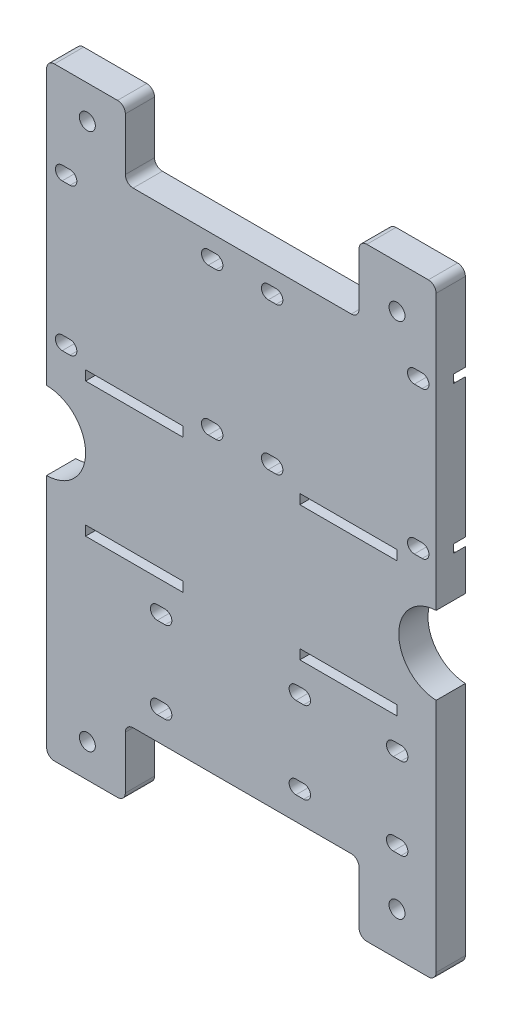
from build123d import *

# Parameters (mm, degrees)
SKETCH1_W                            = 100
SKETCH1_H                            = 155
BOSS_EXTRUDE1_DEPTH                  = 7.5
SKETCH2_R                            = 2.05
SKETCH2_W                            = 60
SKETCH2_H                            = 17.5
HOLE_CUTOUTS_DEPTH                   = 185.611077674
SKETCH3_W                            = 25
SKETCH3_H                            = 2.5
BATTERY_STRAP_HOLES_DEPTH            = 185.611077674
H_BRIDGE_HOLES_DEPTH                 = 7.5
BATTERY_PROTECTION_BOARD_HOLES_DEPTH = 185.611077674
VOLTAGE_STEP_DOWN_BOARD_DEPTH        = 185.611077674
FILLET1_R                            = 2
CAMERA_WIRE_HOLE_DEPTH               = 185.611077674
BORE_START                           = -3
BORE_HOLES_DEPTH                     = 3


with BuildPart() as part:
    # Sketch1 → Boss-Extrude1 (new body)
    with BuildSketch(Plane.XY):
        with Locations((50, 77.5)):
            Rectangle(SKETCH1_W, SKETCH1_H)
    extrude(amount=BOSS_EXTRUDE1_DEPTH)

    # Sketch2 → Hole cutouts (cut, through all)
    with BuildSketch(Plane.XY.offset(7.5)):
        with Locations((10.45, 146.45)):
            Circle(SKETCH2_R)
        with Locations((89.95, 143.95)):
            Circle(SKETCH2_R)
        with Locations((89.95, 11.05)):
            Circle(SKETCH2_R)
        with Locations((10.45, 8.55)):
            Circle(SKETCH2_R)
        with Locations((50.2, 146.25)):
            Rectangle(SKETCH2_W, SKETCH2_H)
        with Locations((50.2, 8.75)):
            Rectangle(SKETCH2_W, SKETCH2_H)
    extrude(amount=-HOLE_CUTOUTS_DEPTH, mode=Mode.SUBTRACT)

    # Sketch3 → Battery strap holes (cut, through all)
    with BuildSketch(Plane.XY.offset(7.5)):
        with Locations((77.5, 55.25)):
            Rectangle(SKETCH3_W, SKETCH3_H)
        with Locations((22.5, 55.25)):
            Rectangle(SKETCH3_W, SKETCH3_H)
        with Locations((77.5, 89.75)):
            Rectangle(SKETCH3_W, SKETCH3_H)
        with Locations((22.5, 89.75)):
            Rectangle(SKETCH3_W, SKETCH3_H)
    extrude(amount=-BATTERY_STRAP_HOLES_DEPTH, mode=Mode.SUBTRACT)

    # Sketch4 → H-Bridge Holes (cut)
    with BuildSketch(Plane.XY.offset(7.5)):
        with BuildLine():
            Line((6, 133.51), (4, 133.51))
            ThreePointArc((4, 133.51), (2.25, 131.76), (4, 130.01))
            Line((4, 130.01), (6, 130.01))
            ThreePointArc((6, 130.01), (7.75, 131.76), (6, 133.51))
        make_face()
        with BuildLine():
            ThreePointArc((41.5, 133.51), (39.75, 131.76), (41.5, 130.01))
            Line((41.5, 130.01), (43.5, 130.01))
            ThreePointArc((43.5, 130.01), (45.25, 131.76), (43.5, 133.51))
            Line((43.5, 133.51), (41.5, 133.51))
        make_face()
        with BuildLine():
            Line((6, 95.75), (4, 95.75))
            ThreePointArc((4, 95.75), (2.25, 94), (4, 92.25))
            Line((4, 92.25), (6, 92.25))
            ThreePointArc((6, 92.25), (7.75, 94), (6, 95.75))
        make_face()
        with BuildLine():
            Line((43.5, 95.75), (41.5, 95.75))
            ThreePointArc((41.5, 95.75), (39.75, 94), (41.5, 92.25))
            Line((41.5, 92.25), (43.5, 92.25))
            ThreePointArc((43.5, 92.25), (45.25, 94), (43.5, 95.75))
        make_face()
    h_bridge_holes = extrude(amount=-H_BRIDGE_HOLES_DEPTH, mode=Mode.SUBTRACT)

    # Sketch6 → Battery Protection Board Holes (cut, through all)
    with BuildSketch(Plane.XY.offset(7.5)):
        with BuildLine():
            Line((66, 27), (64, 27))
            ThreePointArc((64, 27), (62.25, 25.25), (64, 23.5))
            Line((64, 23.5), (66, 23.5))
            ThreePointArc((66, 23.5), (67.75, 25.25), (66, 27))
        make_face()
        with BuildLine():
            ThreePointArc((89, 27), (87.25, 25.25), (89, 23.5))
            Line((89, 23.5), (91, 23.5))
            ThreePointArc((91, 23.5), (92.75, 25.25), (91, 27))
            Line((91, 27), (89, 27))
        make_face()
        with BuildLine():
            Line((64, 44.5), (66, 44.5))
            ThreePointArc((66, 44.5), (67.75, 46.25), (66, 48))
            Line((66, 48), (64, 48))
            ThreePointArc((64, 48), (62.25, 46.25), (64, 44.5))
        make_face()
        with BuildLine():
            Line((89, 44.5), (91, 44.5))
            ThreePointArc((91, 44.5), (92.75, 46.25), (91, 48))
            Line((91, 48), (89, 48))
            ThreePointArc((89, 48), (87.25, 46.25), (89, 44.5))
        make_face()
    extrude(amount=-BATTERY_PROTECTION_BOARD_HOLES_DEPTH, mode=Mode.SUBTRACT)

    # Sketch7 → Voltage Step Down Board (cut, through all)
    with BuildSketch(Plane.XY.offset(7.5)):
        with BuildLine():
            Line((28.4, 48), (30.4, 48))
            ThreePointArc((30.4, 48), (32.15, 46.25), (30.4, 44.5))
            Line((30.4, 44.5), (28.4, 44.5))
            ThreePointArc((28.4, 44.5), (26.65, 46.25), (28.4, 48))
        make_face()
        with BuildLine():
            Line((28.4, 23.5), (30.4, 23.5))
            ThreePointArc((30.4, 23.5), (32.15, 25.25), (30.4, 27))
            Line((30.4, 27), (28.4, 27))
            ThreePointArc((28.4, 27), (26.65, 25.25), (28.4, 23.5))
        make_face()
    extrude(amount=-VOLTAGE_STEP_DOWN_BOARD_DEPTH, mode=Mode.SUBTRACT)

    # Fillet1
    fillet1_edges = [part.edges().sort_by_distance(p)[0] for p in [
        (0, 0, 3.75),
        (20.2, 0, 3.75),
        (20.2, 17.5, 3.75),
        (80.2, 17.5, 3.75),
        (80.2, 0, 3.75),
        (100, 0, 3.75),
        (100, 155, 3.75),
        (80.2, 155, 3.75),
        (80.2, 137.5, 3.75),
        (20.2, 137.5, 3.75),
        (20.2, 155, 3.75),
        (0, 155, 3.75),
    ]]
    fillet(fillet1_edges, radius=FILLET1_R)

    # Sketch9 → Camera Wire Hole (cut, through all)
    with BuildSketch(Plane.XY.offset(7.5)):
        with BuildLine():
            Line((0, 82.5), (0, 62.5))
            ThreePointArc((0, 62.5), (10, 72.5), (0, 82.5))
        make_face()
    camera_wire_hole = extrude(amount=-CAMERA_WIRE_HOLE_DEPTH, mode=Mode.SUBTRACT)

    # Mirror1: H-Bridge Holes, Camera Wire Hole across plane
    add(h_bridge_holes.mirror(Plane(origin=(50.2, 0, 0), x_dir=(0, 0, 1), z_dir=(1, 0, 0))), mode=Mode.SUBTRACT)
    add(camera_wire_hole.mirror(Plane(origin=(50.2, 0, 0), x_dir=(0, 0, 1), z_dir=(1, 0, 0))), mode=Mode.SUBTRACT)

    # Sketch10 → Bore Holes (cut)
    # profile 1 of 4: a face of its own
    with BuildSketch(Plane(origin=(0, 0, 0), x_dir=(-1, 0, 0), z_dir=(0, 0, -1)).offset(BORE_START)):
        with BuildLine():
            Line((-96.4, 135.51), (-94.4, 135.51))
            ThreePointArc((-94.4, 135.51), (-90.65, 131.76), (-94.4, 128.01))
            Line((-94.4, 128.01), (-96.4, 128.01))
            ThreePointArc((-96.4, 128.01), (-100.15, 131.76), (-96.4, 135.51))
        make_face()
        with BuildLine():
            Line((-96.4, 133.51), (-94.4, 133.51))
            ThreePointArc((-94.4, 133.51), (-92.65, 131.76), (-94.4, 130.01))
            Line((-94.4, 130.01), (-96.4, 130.01))
            ThreePointArc((-96.4, 130.01), (-98.15, 131.76), (-96.4, 133.51))
        make_face(mode=Mode.SUBTRACT)
    # profile 2 of 4: a face of its own
    with BuildSketch(Plane(origin=(0, 0, 0), x_dir=(-1, 0, 0), z_dir=(0, 0, -1)).offset(BORE_START)):
        with BuildLine():
            Line((-58.9, 135.51), (-56.9, 135.51))
            ThreePointArc((-56.9, 135.51), (-53.15, 131.76), (-56.9, 128.01))
            Line((-56.9, 128.01), (-58.9, 128.01))
            ThreePointArc((-58.9, 128.01), (-62.65, 131.76), (-58.9, 135.51))
        make_face()
        with BuildLine():
            Line((-58.9, 133.51), (-56.9, 133.51))
            ThreePointArc((-56.9, 133.51), (-55.15, 131.76), (-56.9, 130.01))
            Line((-56.9, 130.01), (-58.9, 130.01))
            ThreePointArc((-58.9, 130.01), (-60.65, 131.76), (-58.9, 133.51))
        make_face(mode=Mode.SUBTRACT)
    # profile 3 of 4: a face of its own
    with BuildSketch(Plane(origin=(0, 0, 0), x_dir=(-1, 0, 0), z_dir=(0, 0, -1)).offset(BORE_START)):
        with BuildLine():
            Line((-96.4, 97.75), (-94.4, 97.75))
            ThreePointArc((-94.4, 97.75), (-90.65, 94), (-94.4, 90.25))
            Line((-94.4, 90.25), (-96.4, 90.25))
            ThreePointArc((-96.4, 90.25), (-100.15, 94), (-96.4, 97.75))
        make_face()
        with BuildLine():
            Line((-96.4, 95.75), (-94.4, 95.75))
            ThreePointArc((-94.4, 95.75), (-92.65, 94), (-94.4, 92.25))
            Line((-94.4, 92.25), (-96.4, 92.25))
            ThreePointArc((-96.4, 92.25), (-98.15, 94), (-96.4, 95.75))
        make_face(mode=Mode.SUBTRACT)
    # profile 4 of 4: a face of its own
    with BuildSketch(Plane(origin=(0, 0, 0), x_dir=(-1, 0, 0), z_dir=(0, 0, -1)).offset(BORE_START)):
        with BuildLine():
            Line((-58.9, 97.75), (-56.9, 97.75))
            ThreePointArc((-56.9, 97.75), (-53.15, 94), (-56.9, 90.25))
            Line((-56.9, 90.25), (-58.9, 90.25))
            ThreePointArc((-58.9, 90.25), (-62.65, 94), (-58.9, 97.75))
        make_face()
        with BuildLine():
            Line((-58.9, 92.25), (-56.9, 92.25))
            ThreePointArc((-56.9, 92.25), (-55.15, 94), (-56.9, 95.75))
            Line((-56.9, 95.75), (-58.9, 95.75))
            ThreePointArc((-58.9, 95.75), (-60.65, 94), (-58.9, 92.25))
        make_face(mode=Mode.SUBTRACT)
    extrude(amount=BORE_HOLES_DEPTH, mode=Mode.SUBTRACT)


solid = part.part
